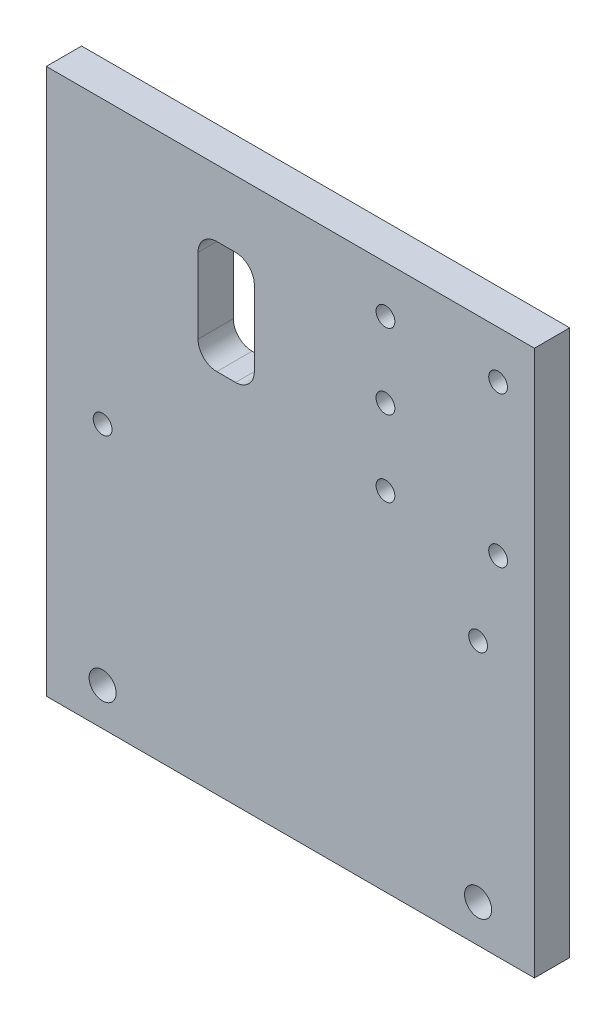
from build123d import *

# Parameters (mm, degrees)
SKETCH1_W           = 130
SKETCH1_H           = 145.26
SKETCH1_R           = 3.6
SKETCH1_R_2         = 2.5
BOSS_EXTRUDE1_DEPTH = 9.4
SKETCH2_W           = 15
SKETCH2_H           = 30
CUT_EXTRUDE1_DEPTH  = 178.788153711
FILLET1_R           = 5


with BuildPart() as part:
    # Sketch1 → Boss-Extrude1 (new body)
    with BuildSketch(Plane.XY):
        with Locations((50, 62.63)):
            Rectangle(SKETCH1_W, SKETCH1_H)
        Circle(SKETCH1_R, mode=Mode.SUBTRACT)
        with Locations((0, 60.26)):
            Circle(SKETCH1_R_2, mode=Mode.SUBTRACT)
        with Locations((100, 60.26)):
            Circle(SKETCH1_R_2, mode=Mode.SUBTRACT)
        with Locations((100, 0)):
            Circle(SKETCH1_R, mode=Mode.SUBTRACT)
        with Locations((75.33, 82.555)):
            Circle(SKETCH1_R_2, mode=Mode.SUBTRACT)
        with Locations((105.33, 82.555)):
            Circle(SKETCH1_R_2, mode=Mode.SUBTRACT)
        with Locations((105.33, 122.635)):
            Circle(SKETCH1_R_2, mode=Mode.SUBTRACT)
        with Locations((75.33, 102.766411568)):
            Circle(SKETCH1_R_2, mode=Mode.SUBTRACT)
        with Locations((75.33, 122.766411568)):
            Circle(SKETCH1_R_2, mode=Mode.SUBTRACT)
    extrude(amount=BOSS_EXTRUDE1_DEPTH)

    # Sketch2 → Cut-Extrude1 (cut, through all)
    with BuildSketch(Plane(origin=(0, 0, 0), x_dir=(-1, 0, 0), z_dir=(0, 0, -1))):
        with Locations((-32.90754614, 102.570367495)):
            Rectangle(SKETCH2_W, SKETCH2_H)
    extrude(amount=-CUT_EXTRUDE1_DEPTH, mode=Mode.SUBTRACT)

    # Fillet1
    fillet1_edges = [part.edges().sort_by_distance(p)[0] for p in [
        (25.40754614, 117.570367495, 4.7),
        (40.40754614, 117.570367495, 4.7),
        (25.40754614, 87.570367495, 4.7),
        (40.40754614, 87.570367495, 4.7),
    ]]
    fillet(fillet1_edges, radius=FILLET1_R)


solid = part.part
